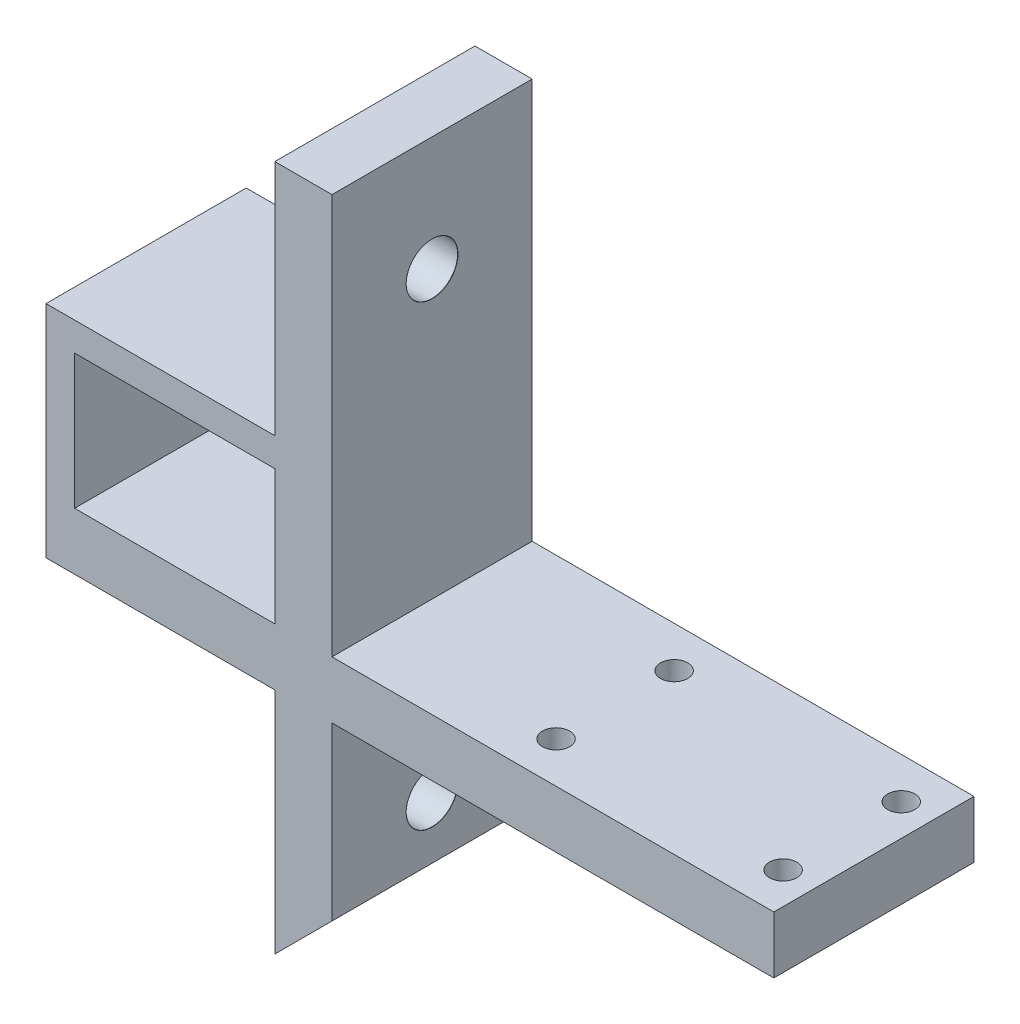
from build123d import *

# Parameters (mm, degrees)
BOSS_EXTRUDE1_OUTLINE_W        = 127.25
BOSS_EXTRUDE1_OUTLINE_H        = 35
BOSS_EXTRUDE1_OUTLINE_R        = 2.38125
BOSS_EXTRUDE1_DEPTH            = 10
BOSS_EXTRUDE2_DEPTH            = 70
BOSS_EXTRUDE2_DEPTH_BACK       = 50
SKETCH2_W                      = 10
SKETCH2_H                      = 35
CHAMFER1_SIZE                  = 10
SKETCH8_W                      = 35
SKETCH8_H                      = 5
BOSS_EXTRUDE4_DEPTH            = 40
SKETCH9_W                      = 35
SKETCH9_H                      = 23.5
BOSS_EXTRUDE5_DEPTH            = 5
M8_CLEARANCE_HOLE2_D           = 9
M8_CLEARANCE_HOLE2_DEPTH       = 23
M8_CLEARANCE_HOLE2_CSINK_D     = 9.05
M8_CLEARANCE_HOLE2_CSINK_ANGLE = 90
M8_CLEARANCE_HOLE2_TIP         = 2.703872786


# Read off the part's stored shape, not the designer's step: Boss-Extrude1
with BuildPart() as part:
    # Boss-Extrude1 outline → Boss-Extrude1 (new body)
    with BuildSketch(Plane(origin=(0, 0, 0), x_dir=(1, 0, 0), z_dir=(0, 1, 0))):
        with Locations((-38.225, 0)):
            Rectangle(BOSS_EXTRUDE1_OUTLINE_W, BOSS_EXTRUDE1_OUTLINE_H)
        with Locations((-19.85, -10.3252)):
            Circle(BOSS_EXTRUDE1_OUTLINE_R, mode=Mode.SUBTRACT)
        with Locations((19.8502, -10.3252)):
            Circle(BOSS_EXTRUDE1_OUTLINE_R, mode=Mode.SUBTRACT)
        with Locations((-19.85, 10.325)):
            Circle(BOSS_EXTRUDE1_OUTLINE_R, mode=Mode.SUBTRACT)
        with Locations((19.8502, 10.325)):
            Circle(BOSS_EXTRUDE1_OUTLINE_R, mode=Mode.SUBTRACT)
    extrude(amount=BOSS_EXTRUDE1_DEPTH)

    # Sketch2 → Boss-Extrude2 (add, two sides: drawn at the far end of the back side and taken through both)
    with BuildSketch(Plane(origin=(0, 10, 0), x_dir=(1, 0, 0), z_dir=(0, 1, 0)).offset(-BOSS_EXTRUDE2_DEPTH_BACK)):
        with Locations((-56.85, 0)):
            Rectangle(SKETCH2_W, SKETCH2_H)
    extrude(amount=BOSS_EXTRUDE2_DEPTH + BOSS_EXTRUDE2_DEPTH_BACK)

    # Chamfer1
    chamfer1_edges = [part.edges().sort_by_distance(p)[0] for p in [
        (-51.85, -40, 0),
    ]]
    chamfer(chamfer1_edges, length=CHAMFER1_SIZE - 0.0001)  # a hair under: the kernel refuses the full size

    # Sketch8 → Boss-Extrude4 (add)
    with BuildSketch(Plane.ZY.offset(61.85)):
        with Locations((0, 36)):
            Rectangle(SKETCH8_W, SKETCH8_H)
    extrude(amount=BOSS_EXTRUDE4_DEPTH)

    # Sketch9 → Boss-Extrude5 (add)
    with BuildSketch(Plane.ZY.offset(101.85)):
        with Locations((0, 21.75)):
            Rectangle(SKETCH9_W, SKETCH9_H)
    extrude(amount=-BOSS_EXTRUDE5_DEPTH)

    # M8 Clearance Hole2
    with Locations(Plane(origin=(-51.85, 0, 0), x_dir=(0, 0, -1), z_dir=(1, 0, 0))):
        with Locations((0, 60), (0, -20)):
            CounterSinkHole(M8_CLEARANCE_HOLE2_D / 2, M8_CLEARANCE_HOLE2_CSINK_D / 2, depth=M8_CLEARANCE_HOLE2_DEPTH, counter_sink_angle=M8_CLEARANCE_HOLE2_CSINK_ANGLE)
            with Locations((0, 0, -(M8_CLEARANCE_HOLE2_DEPTH + M8_CLEARANCE_HOLE2_TIP / 2))):  # 118° drill point
                Cone(0, M8_CLEARANCE_HOLE2_D / 2, M8_CLEARANCE_HOLE2_TIP, mode=Mode.SUBTRACT)


solid = part.part
